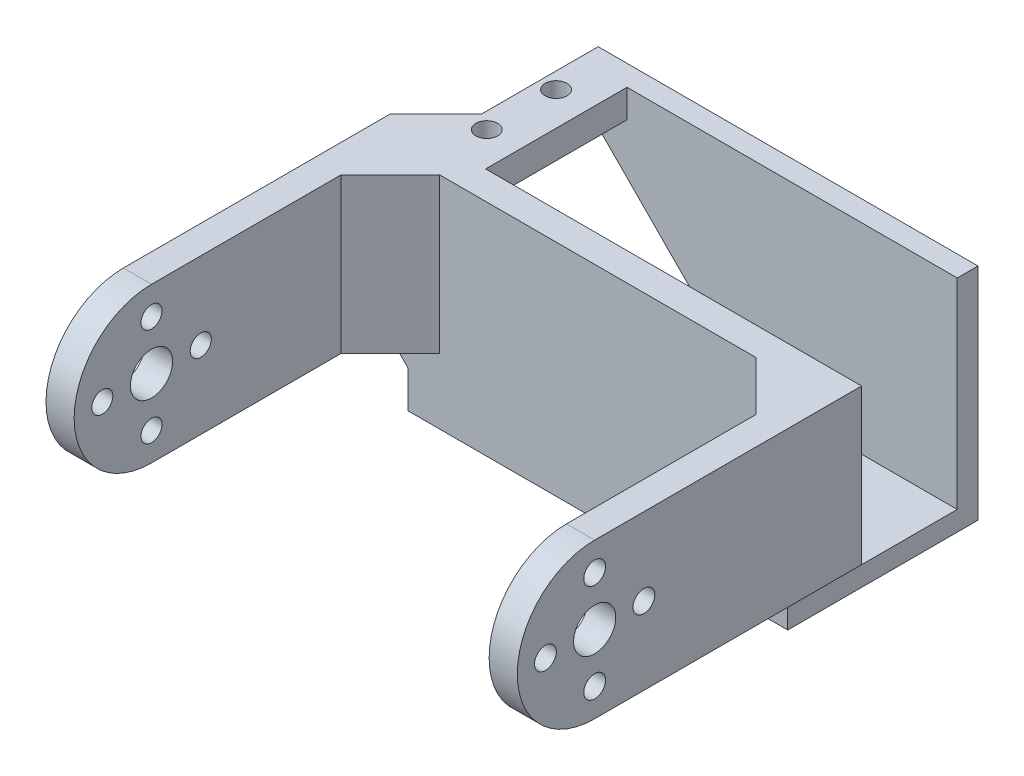
from build123d import *

# Parameters (mm, degrees)
BOSS_EXTRUDE1_DEPTH      = 22
SKETCH3_R                = 1.55
CUT_EXTRUDE1_DEPTH       = 30
CUT_EXTRUDE5_DEPTH       = 9
SKETCH11_R               = 1.55
CUT_EXTRUDE10_DEPTH      = 13
CUT_EXTRUDE11_START      = -10
CUT_EXTRUDE11_DEPTH      = 10
SKETCH13_R               = 3
SKETCH13_R_2             = 1.5
CUT_EXTRUDE12_DEPTH      = 85
FILLET1_SIZE             = 7
SKETCH14_W               = 54
SKETCH14_H               = 9.3
SKETCH14_W_2             = 7.05
SKETCH14_H_2             = 4
BOSS_EXTRUDE4_DEPTH      = 4
SKETCH17_W               = 7.05
SKETCH17_H               = 4
BOSS_EXTRUDE5_DEPTH      = 23.05
BOSS_EXTRUDE6_DEPTH      = 27.3
BOSS_EXTRUDE6_DEPTH_BACK = 4
SKETCH18_W               = 54
SKETCH18_H               = 2.95
SKETCH19_W               = 54
SKETCH19_H               = 2.8
BOSS_EXTRUDE7_DEPTH      = 21
FILLET2_SIZE             = 6.5
FILLET7_SIZE             = 4
SKETCH26_R               = 1.55
CUT_EXTRUDE18_DEPTH      = 11.5
CUT_EXTRUDE19_START      = -4
CUT_EXTRUDE19_OUTLINE_R  = 1.55
CUT_EXTRUDE19_DEPTH      = 4
CUT_EXTRUDE21_DEPTH      = 23.05
SKETCH31_R               = 2.625
BOSS_EXTRUDE8_DEPTH      = 6
FILLET8_R                = 0.5


# Read off the part's stored shape, not the designer's step: Cut-Extrude19
with BuildPart() as part:
    # Sketch1 → Boss-Extrude1 (new body)
    with BuildSketch(Plane(origin=(0, 0, 0), x_dir=(1, 0, 0), z_dir=(0, 1, 0))):
        Polygon((0, 0), (0, 50), (67, 50), (67, 0), (63, 0), (63, 46), (4, 46), (4, 0), align=None)
    extrude(amount=BOSS_EXTRUDE1_DEPTH)

    # Sketch3 → Cut-Extrude1 (cut)
    with BuildSketch(Plane(origin=(67, 0, 0), x_dir=(0, 0, -1), z_dir=(1, 0, 0))):
        with Locations((12.05, 11)):
            Circle(SKETCH3_R)
    extrude(amount=-CUT_EXTRUDE1_DEPTH, mode=Mode.SUBTRACT)

    # Sketch5 → Cut-Extrude5 (cut)
    with BuildSketch(Plane(origin=(67, 0, 0), x_dir=(0, 0, -1), z_dir=(1, 0, 0))):
        with BuildLine():
            Line((12.05, 22), (0, 22))
            Line((0, 22), (0, 0))
            Line((0, 0), (12.05, 0))
            ThreePointArc((12.05, 0), (1.05, 11), (12.05, 22))
        make_face()
    extrude(amount=-CUT_EXTRUDE5_DEPTH, mode=Mode.SUBTRACT)

    # Sketch11 → Cut-Extrude10 (cut)
    with BuildSketch(Plane(origin=(67, 0, 0), x_dir=(0, 0, -1), z_dir=(1, 0, 0))):
        with Locations((19.05, 11)):
            Circle(SKETCH11_R)
        with Locations((12.05, 18)):
            Circle(SKETCH11_R)
        with Locations((12.05, 4)):
            Circle(SKETCH11_R)
        with Locations((5.05, 11)):
            Circle(SKETCH11_R)
    extrude(amount=-CUT_EXTRUDE10_DEPTH, mode=Mode.SUBTRACT)

    # Sketch12 → Cut-Extrude11 (cut)
    with BuildSketch(Plane.ZY.offset(CUT_EXTRUDE11_START)):
        with BuildLine():
            Line((-12.05, 22), (0, 22))
            Line((0, 22), (0, 0))
            Line((0, 0), (-12.05, 0))
            ThreePointArc((-12.05, 0), (-1.05, 11), (-12.05, 22))
        make_face()
    extrude(amount=CUT_EXTRUDE11_DEPTH, mode=Mode.SUBTRACT)

    # Sketch13 → Cut-Extrude12 (cut)
    with BuildSketch(Plane.ZY):
        with Locations((-12.05, 11)):
            Circle(SKETCH13_R)
        with Locations((-19.05, 11)):
            Circle(SKETCH13_R_2)
        with Locations((-12.05, 4)):
            Circle(SKETCH13_R_2)
        with Locations((-5.05, 11)):
            Circle(SKETCH13_R_2)
        with Locations((-12.05, 18)):
            Circle(SKETCH13_R_2)
    extrude(amount=-CUT_EXTRUDE12_DEPTH, mode=Mode.SUBTRACT)

    # Fillet1
    fillet1_edges = [part.edges().sort_by_distance(p)[0] for p in [
        (63, 11, -46),
        (4, 11, -46),
    ]]
    chamfer(fillet1_edges, length=FILLET1_SIZE)

    # Sketch14 → Boss-Extrude4 (add)
    with BuildSketch(Plane(origin=(0, 0, -50), x_dir=(-1, 0, 0), z_dir=(0, 0, -1))):
        with Locations((-33.5, -4.65)):
            Rectangle(SKETCH14_W, SKETCH14_H)
        with Locations((-56.975, 20)):
            Rectangle(SKETCH14_W_2, SKETCH14_H_2)
        with Locations((-10.025, 20)):
            Rectangle(SKETCH14_W_2, SKETCH14_H_2)
    extrude(amount=-BOSS_EXTRUDE4_DEPTH)

    # Sketch17 → Boss-Extrude5 (add)
    with BuildSketch(Plane(origin=(0, 0, -50), x_dir=(-1, 0, 0), z_dir=(0, 0, -1))):
        with Locations((-56.975, 20)):
            Rectangle(SKETCH17_W, SKETCH17_H)
        with Locations((-10.025, 20)):
            Rectangle(SKETCH17_W, SKETCH17_H)
    extrude(amount=BOSS_EXTRUDE5_DEPTH)

    # Sketch18 → Boss-Extrude6 (add, two sides: drawn at the far end of the back side and taken through both)
    with BuildSketch(Plane.XZ.offset(-18).offset(-BOSS_EXTRUDE6_DEPTH_BACK)):
        with Locations((33.5, -71.575)):
            Rectangle(SKETCH18_W, SKETCH18_H)
    extrude(amount=BOSS_EXTRUDE6_DEPTH + BOSS_EXTRUDE6_DEPTH_BACK)

    # Sketch19 → Boss-Extrude7 (add)
    with BuildSketch(Plane(origin=(0, 0, -50), x_dir=(-1, 0, 0), z_dir=(0, 0, -1))):
        with Locations((-33.5, -7.9)):
            Rectangle(SKETCH19_W, SKETCH19_H)
    extrude(amount=BOSS_EXTRUDE7_DEPTH)

    # Fillet2
    fillet2_edges = [part.edges().sort_by_distance(p)[0] for p in [
        (60.5, 20, -50),
        (6.5, 20, -50),
    ]]
    chamfer(fillet2_edges, length=FILLET2_SIZE - 0.0001)  # a hair under: the kernel refuses the full size

    # Fillet7
    fillet7_edges = [part.edges().sort_by_distance(p)[0] for p in [
        (6.5, 0, -48),
    ]]
    chamfer(fillet7_edges, length=FILLET7_SIZE)

    # Sketch26 → Cut-Extrude18 (cut)
    with BuildSketch(Plane(origin=(0, 22, 0), x_dir=(1, 0, 0), z_dir=(0, 1, 0))):
        with Locations(Location((58.21, 64.77, 0), (0, 0, 270))):
            Circle(SKETCH26_R)
        with Locations(Location((58.21, 54.92, 0), (0, 0, 270))):
            Circle(SKETCH26_R)
        with Locations(Location((8.79, 54.92, 0), (0, 0, 270))):
            Circle(SKETCH26_R)
        with Locations(Location((8.79, 64.77, 0), (0, 0, 270))):
            Circle(SKETCH26_R)
    extrude(amount=-CUT_EXTRUDE18_DEPTH, mode=Mode.SUBTRACT)

    # Cut-Extrude19 outline → Cut-Extrude19 (cut)
    with BuildSketch(Plane(origin=(0, 22, 0), x_dir=(1, 0, 0), z_dir=(0, 1, 0)).offset(CUT_EXTRUDE19_START)):
        Polygon((53.45, 70.1), (53.45, 50), (67, 50), (60.5, 56.5), (60.5, 70.1), align=None)
        with Locations((58.21, 54.92)):
            Circle(CUT_EXTRUDE19_OUTLINE_R, mode=Mode.SUBTRACT)
        with Locations((58.21, 64.77)):
            Circle(CUT_EXTRUDE19_OUTLINE_R, mode=Mode.SUBTRACT)
    extrude(amount=CUT_EXTRUDE19_DEPTH, mode=Mode.SUBTRACT)

    # Sketch30 → Cut-Extrude21 (cut)
    with BuildSketch(Plane(origin=(0, 0, -73.05), x_dir=(-1, 0, 0), z_dir=(0, 0, -1))):
        Polygon((-6.5, 18), (-33.5, -9.3), (-6.5, -9.3), align=None)
    extrude(amount=-CUT_EXTRUDE21_DEPTH, mode=Mode.SUBTRACT)

    # Sketch31 → Boss-Extrude8 (add)
    with BuildSketch(Plane.XZ.offset(9.3)):
        with Locations(Location((43.6, -59.85, 0), (0, 0, 270))):
            Circle(SKETCH31_R)
    extrude(amount=BOSS_EXTRUDE8_DEPTH)

    # Fillet8
    fillet8_edges = [part.edges().sort_by_distance(p)[0] for p in [
        (43.6, -15.3, -57.225),
    ]]
    fillet(fillet8_edges, radius=FILLET8_R)


solid = part.part
